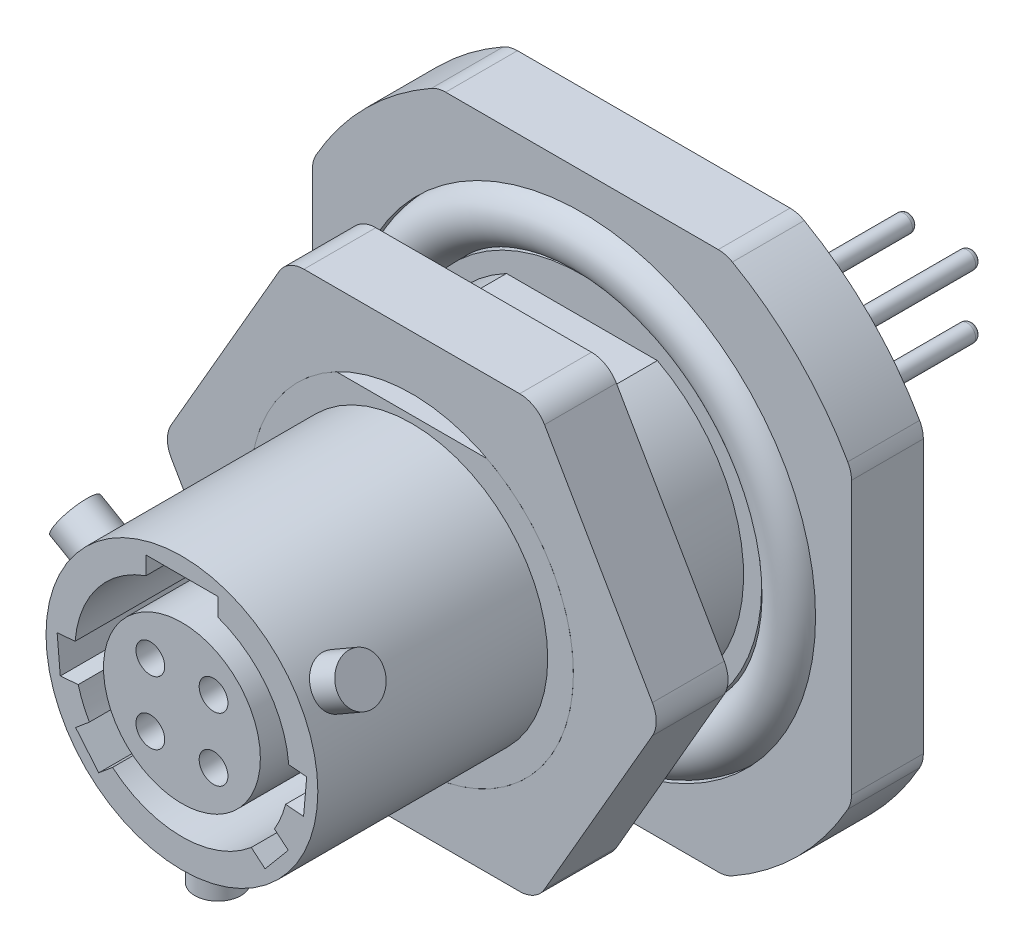
from build123d import *

# Parameters (mm, degrees)
BOSS_EXTRUDE1_DEPTH         = 3.175
SKETCH3_R                   = 10.3251
SKETCH3_R_2                 = 7.94385
CUT_EXTRUDE1_DEPTH          = 1.5875
CUT_EXTRUDE2_DEPTH          = 7.5184
SKETCH5_R                   = 7.14375
BOSS_EXTRUDE2_DEPTH         = 3.175
SKETCH6_R                   = 4.7371
SKETCH6_R_2                 = 3.4671
CUT_EXTRUDE3_DEPTH          = 12.7
SKETCH7_R                   = 3.96875
CUT_EXTRUDE4_DEPTH          = 3.175
SKETCH8_R                   = 1.016
BOSS_EXTRUDE3_DEPTH         = 1.27
CIRPATTERN1_COUNT           = 3
SKETCH12_W                  = 3.175
SKETCH12_H                  = 0.79375
CUT_EXTRUDE6_DEPTH          = 6.35
FILLET2_R                   = 1.27
FILLET3_R                   = 1.27
SKETCH10_R                  = 0.635
CUT_EXTRUDE5_DEPTH          = 6.35
SKETCH11_R                  = 0.381
BOSS_EXTRUDE4_DEPTH         = 15.875
FILLET1_R                   = 0.254
SKETCH_PATTERN1_START       = 14.5034
SKETCH_PATTERN1_4_OUTLINE_R = 0.635
SKETCH_PATTERN1_4_DEPTH     = 6.35


# Read off the part's stored shape, not the designer's step: Sketch-Pattern1
with BuildPart() as part:
    # Sketch1 → Boss-Extrude1 (new body)
    with BuildSketch(Plane.XY):
        with BuildLine():
            Line((-6.35, -11.9126), (6.35, -11.9126))
            ThreePointArc((6.35, -11.9126), (9.54548424, -9.54548424), (11.9126, -6.35))
            Line((11.9126, -6.35), (11.9126, 6.35))
            ThreePointArc((11.9126, 6.35), (9.54548424, 9.54548424), (6.35, 11.9126))
            Line((6.35, 11.9126), (-6.35, 11.9126))
            ThreePointArc((-6.35, 11.9126), (-9.54548424, 9.54548424), (-11.9126, 6.35))
            Line((-11.9126, 6.35), (-11.9126, -6.35))
            ThreePointArc((-11.9126, -6.35), (-9.54548424, -9.54548424), (-6.35, -11.9126))
        make_face()
    extrude(amount=BOSS_EXTRUDE1_DEPTH)

    # Sketch2 → Revolve1 (revolve)
    with BuildSketch(Plane(origin=(0, 0, 0), x_dir=(0, 0, -1), z_dir=(1, 0, 0)), mode=Mode.PRIVATE) as revolve1_sk:
        Polygon((-3.175, 0), (-20.8534, 0), (-20.8534, 6.0071), (-10.6934, 6.0071), (-10.6934, 7.14375), (-3.175, 7.14375), align=None)
    revolve(revolve1_sk.sketch.rotate(Axis((0, 0, 3.175), (0, 0, -1)), 90), axis=Axis((0, 0, 3.175), (0, 0, -1)))

    # Sketch3 → Cut-Extrude1 (cut)
    with BuildSketch(Plane.XY.offset(3.175)):
        Circle(SKETCH3_R)
        Circle(SKETCH3_R_2, mode=Mode.SUBTRACT)
    extrude(amount=-CUT_EXTRUDE1_DEPTH, mode=Mode.SUBTRACT)

    # Sketch4 → Cut-Extrude2 (cut)
    with BuildSketch(Plane.XY.offset(10.6934)):
        Polygon((-60.865081836, 6.31825), (-3.333598806, 6.31825), (3.333598806, 6.31825), (60.865081836, 6.31825), (60.865081836, 121.38121606), (-60.865081836, 121.38121606), align=None)
    extrude(amount=-CUT_EXTRUDE2_DEPTH, mode=Mode.SUBTRACT)

    # Sketch6 → Cut-Extrude3 (cut)
    with BuildSketch(Plane.XY.offset(20.8534)):
        Circle(SKETCH6_R)
        Circle(SKETCH6_R_2, mode=Mode.SUBTRACT)
    extrude(amount=-CUT_EXTRUDE3_DEPTH, mode=Mode.SUBTRACT)

    # Sketch7 → Cut-Extrude4 (cut)
    with BuildSketch(Plane(origin=(0, 0, 0), x_dir=(-1, 0, 0), z_dir=(0, 0, -1))):
        Circle(SKETCH7_R)
    extrude(amount=-CUT_EXTRUDE4_DEPTH, mode=Mode.SUBTRACT)

    # Sketch8 → Boss-Extrude3 (add, symmetric)
    with BuildSketch(Plane(origin=(0, -6.0071, 0), x_dir=(-1, 0, 0), z_dir=(0, -1, 0))):
        with Locations(Location((0, -19.2659, 0), (0, 0, 270))):
            Circle(SKETCH8_R)
    boss_extrude3 = extrude(amount=BOSS_EXTRUDE3_DEPTH, both=True)

    # CirPattern1: Boss-Extrude3 ×3 about axis
    cirpattern1_axis = Axis((0, 0, 0), (0, 0, 1))
    for i in range(1, CIRPATTERN1_COUNT):
        add(boss_extrude3.rotate(cirpattern1_axis, i * 360 / CIRPATTERN1_COUNT))

    # Sketch12 → Cut-Extrude6 (cut)
    with BuildSketch(Plane.XY.offset(20.8534)):
        with Locations((0, 4.860053258)):
            Rectangle(SKETCH12_W, SKETCH12_H)
        Polygon((-4.721284564, 0.386766697), (-4.58239631, -1.200733303), (-5.37614631, -1.270177429), (-5.515034564, 0.317322571), align=None)
        Polygon((-4.089290166, -2.391196844), (-3.064966977, -3.611937685), (-3.675337397, -4.12409928), (-4.699660586, -2.903358439), align=None)
        Polygon((3.675337397, -4.12409928), (4.699660586, -2.903358439), (4.089290166, -2.391196844), (3.064966977, -3.611937685), align=None)
        Polygon((4.721284564, 0.386766697), (4.58239631, -1.200733303), (5.37614631, -1.270177429), (5.515034564, 0.317322571), align=None)
    extrude(amount=-CUT_EXTRUDE6_DEPTH, mode=Mode.SUBTRACT)

    # Fillet3
    fillet3_edges = [part.edges().sort_by_distance(p)[0] for p in [
        (-11.9126, -6.35, 1.5875),
        (-11.9126, 6.35, 1.5875),
        (-6.35, 11.9126, 1.5875),
        (6.35, 11.9126, 1.5875),
        (11.9126, 6.35, 1.5875),
        (11.9126, -6.35, 1.5875),
        (6.35, -11.9126, 1.5875),
        (-6.35, -11.9126, 1.5875),
    ]]
    fillet(fillet3_edges, radius=FILLET3_R)

    # Sketch10 → Cut-Extrude5 (cut)
    with BuildSketch(Plane.XY.offset(20.8534)):
        with Locations((1.397, 1.397)):
            Circle(SKETCH10_R)
    extrude(amount=-CUT_EXTRUDE5_DEPTH, mode=Mode.SUBTRACT)

    # Sketch11 → Boss-Extrude4 (add)
    with BuildSketch(Plane(origin=(0, 0, 3.175), x_dir=(-1, 0, 0), z_dir=(0, 0, -1))):
        with Locations((-1.397, 1.397)):
            Circle(SKETCH11_R)
    extrude(amount=BOSS_EXTRUDE4_DEPTH)

    # Fillet1
    fillet1_edges = [part.edges().sort_by_distance(p)[0] for p in [
        (1.778, 1.397, -12.7),
    ]]
    fillet(fillet1_edges, radius=FILLET1_R)

    # Sketch-Pattern1 outline → Sketch-Pattern1 (revolve)
    with BuildSketch(Plane(origin=(1.397, -1.397, 0), x_dir=(1, 0, 0), z_dir=(0, -1, 0))):
        with BuildLine():
            Line((0, 3.175), (0, -12.7))
            Line((0, -12.7), (0.127, -12.7))
            ThreePointArc((0.127, -12.7), (0.306605122, -12.625605122), (0.381, -12.446))
            Line((0.381, -12.446), (0.381, 3.175))
            Line((0.381, 3.175), (0, 3.175))
        make_face()
    revolve(axis=Axis((1.397, -1.397, 0), (0, 0, 1)))

    # Sketch-Pattern1 2 outline → Sketch-Pattern1 2 (revolve)
    with BuildSketch(Plane(origin=(-1.397, -1.397, 0), x_dir=(1, 0, 0), z_dir=(0, -1, 0))):
        with BuildLine():
            Line((0, 3.175), (0, -12.7))
            Line((0, -12.7), (0.127, -12.7))
            ThreePointArc((0.127, -12.7), (0.306605122, -12.625605122), (0.381, -12.446))
            Line((0.381, -12.446), (0.381, 3.175))
            Line((0.381, 3.175), (0, 3.175))
        make_face()
    revolve(axis=Axis((-1.397, -1.397, 0), (0, 0, 1)))

    # Sketch-Pattern1 3 outline → Sketch-Pattern1 3 (revolve)
    with BuildSketch(Plane(origin=(-1.397, 1.397, 0), x_dir=(1, 0, 0), z_dir=(0, -1, 0))):
        with BuildLine():
            Line((0, 3.175), (0, -12.7))
            Line((0, -12.7), (0.127, -12.7))
            ThreePointArc((0.127, -12.7), (0.306605122, -12.625605122), (0.381, -12.446))
            Line((0.381, -12.446), (0.381, 3.175))
            Line((0.381, 3.175), (0, 3.175))
        make_face()
    revolve(axis=Axis((-1.397, 1.397, 0), (0, 0, 1)))

    # Sketch-Pattern1 4 outline → Sketch-Pattern1 4 (cut)
    with BuildSketch(Plane.XY.offset(SKETCH_PATTERN1_START)):
        with Locations((1.397, -1.397)):
            Circle(SKETCH_PATTERN1_4_OUTLINE_R)
        with Locations((-1.397, -1.397)):
            Circle(SKETCH_PATTERN1_4_OUTLINE_R)
        with Locations((-1.397, 1.397)):
            Circle(SKETCH_PATTERN1_4_OUTLINE_R)
    extrude(amount=SKETCH_PATTERN1_4_DEPTH, mode=Mode.SUBTRACT)


with BuildPart() as body_2:
    # Sketch5 → Boss-Extrude2 (new body)
    with BuildSketch(Plane.XY.offset(10.6934)):
        Polygon((-5.499261314, 9.525), (-10.998522628, 0), (-5.499261314, -9.525), (5.499261314, -9.525), (10.998522628, 0), (5.499261314, 9.525), align=None)
        Circle(SKETCH5_R, mode=Mode.SUBTRACT)
    extrude(amount=-BOSS_EXTRUDE2_DEPTH)

    # Fillet2
    fillet2_edges = [body_2.edges().sort_by_distance(p)[0] for p in [
        (5.499261314, 9.525, 9.1059),
        (10.998522628, 0, 9.1059),
        (5.499261314, -9.525, 9.1059),
        (-5.499261314, -9.525, 9.1059),
        (-10.998522628, 0, 9.1059),
        (-5.499261314, 9.525, 9.1059),
    ]]
    fillet(fillet2_edges, radius=FILLET2_R)


with BuildPart() as body_3:
    # Sketch13 → Revolve2 (revolve)
    with BuildSketch(Plane(origin=(0, 0, 0), x_dir=(0, 0, -1), z_dir=(1, 0, 0))):
        with BuildLine():
            Line((-1.5875, 9.636737522), (-1.5875, 8.632212478))
            ThreePointArc((-1.5875, 8.632212478), (-3.857625, 9.134475), (-1.5875, 9.636737522))
        make_face()
    revolve(axis=Axis((0, 0, 0), (0, 0, 1)))


solid = Compound([part.part, body_2.part, body_3.part])
